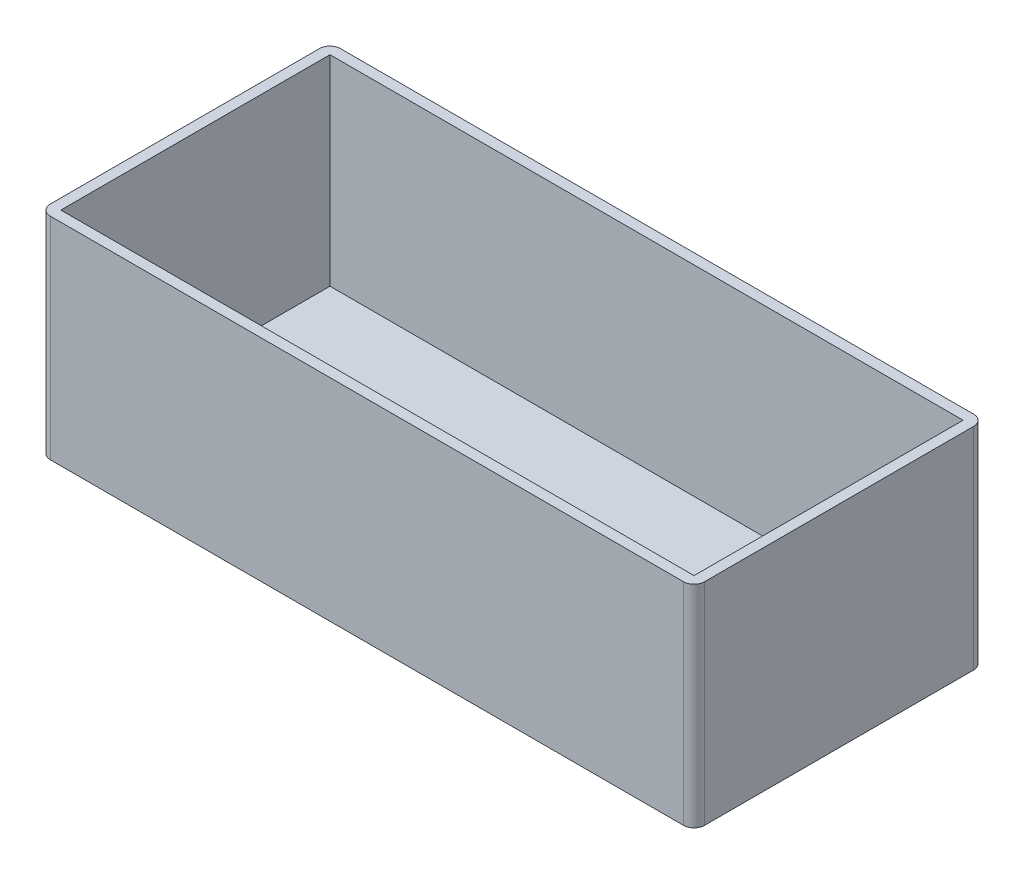
from build123d import *

# Parameters (mm, degrees)
BOSS_EXTRUDE1_DEPTH = 40
SHELL1_START        = 2
SHELL1_OUTLINE_W    = 38
SHELL1_OUTLINE_H    = 51
SHELL1_DEPTH        = 120


# Read off the part's stored shape, not the designer's step: Shell1
with BuildPart() as part:
    # Sketch1 → Boss-Extrude1 (new body)
    with BuildSketch(Plane(origin=(0, 0, 0), x_dir=(1, 0, 0), z_dir=(0, 1, 0))):
        with BuildLine():
            Line((2, 0), (122, 0))
            ThreePointArc((122, 0), (123.414213562, 0.585786438), (124, 2))
            Line((124, 2), (124, 53))
            ThreePointArc((124, 53), (123.414213562, 54.414213562), (122, 55))
            Line((122, 55), (2, 55))
            ThreePointArc((2, 55), (0.585786438, 54.414213562), (0, 53))
            Line((0, 53), (0, 2))
            ThreePointArc((0, 2), (0.585786438, 0.585786438), (2, 0))
        make_face()
    extrude(amount=BOSS_EXTRUDE1_DEPTH)

    # Shell1 outline → Shell1 (cut)
    with BuildSketch(Plane.YZ.offset(SHELL1_START)):
        with Locations((21, -27.5)):
            Rectangle(SHELL1_OUTLINE_W, SHELL1_OUTLINE_H)
    extrude(amount=SHELL1_DEPTH, mode=Mode.SUBTRACT)


solid = part.part
